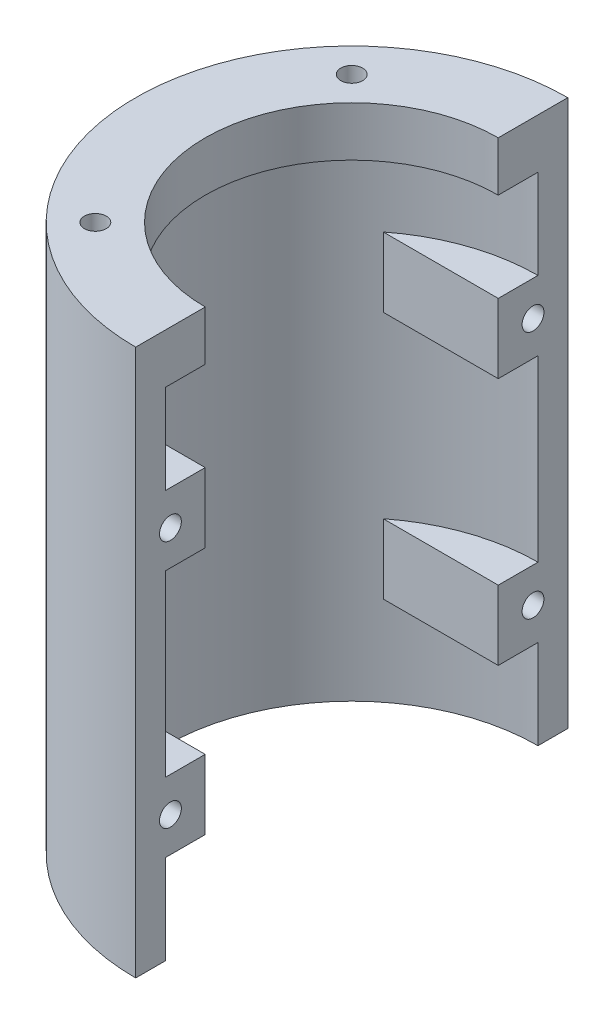
from build123d import *

# Parameters (mm, degrees)
EXTRUDE_1_DEPTH     = 55
CUT_EXTRUDE_START   = -5
SKETCH_2_R          = 18.75
SKETCH_2_R_2        = 14.75
CUT_EXTRUDE_1_DEPTH = 59.016862823
EXTRUDE_3_REACH     = 65.017
SKETCH_4_W          = 7
SKETCH_4_H          = 7
SKETCH_3_R          = 1.1
CUT_EXTRUDE_2_DEPTH = 5
SKETCH_5_R          = 1.1
CUT_EXTRUDE_3_DEPTH = 4


with BuildPart() as part:
    # ｽｹｯﾁ1 → ﾎﾞｽ - 押し出し1 (new body)
    with BuildSketch(Plane(origin=(0, 0, 0), x_dir=(1, 0, 0), z_dir=(0, 1, 0))):
        with BuildLine():
            Line((0, -21.75), (0, -14.75))
            ThreePointArc((0, -14.75), (-14.75, 0), (0, 14.75))
            Line((0, 14.75), (0, 21.75))
            ThreePointArc((0, 21.75), (-21.75, 0), (0, -21.75))
        make_face()
    extrude(amount=EXTRUDE_1_DEPTH)

    # ｽｹｯﾁ2 → ｶｯﾄ - 押し出し1 (cut, through all)
    with BuildSketch(Plane(origin=(0, 55, 0), x_dir=(1, 0, 0), z_dir=(0, 1, 0)).offset(CUT_EXTRUDE_START)):
        Circle(SKETCH_2_R)
        Circle(SKETCH_2_R_2, mode=Mode.SUBTRACT)
    extrude(amount=-CUT_EXTRUDE_1_DEPTH, mode=Mode.SUBTRACT)

    # ｽｹｯﾁ4 → ﾎﾞｽ - 押し出し3 (add, up to next)
    with BuildSketch(Plane(origin=(0, 0, 0), x_dir=(0, 0, -1), z_dir=(1, 0, 0)), mode=Mode.PRIVATE) as extrude_3_sk1:
        with Locations((-18.25, 37.5)):
            Rectangle(SKETCH_4_W, SKETCH_4_H)
    extrude_3_tool1 = extrude(extrude_3_sk1.sketch, amount=-EXTRUDE_3_REACH, mode=Mode.PRIVATE) - part.part
    # ｽｹｯﾁ4 → ﾎﾞｽ - 押し出し3 (add, up to next)
    with BuildSketch(Plane(origin=(0, 0, 0), x_dir=(0, 0, -1), z_dir=(1, 0, 0)), mode=Mode.PRIVATE) as extrude_3_sk2:
        with Locations((-18.25, 12.5)):
            Rectangle(SKETCH_4_W, SKETCH_4_H)
    extrude_3_tool2 = extrude(extrude_3_sk2.sketch, amount=-EXTRUDE_3_REACH, mode=Mode.PRIVATE) - part.part
    # ｽｹｯﾁ4 → ﾎﾞｽ - 押し出し3 (add, up to next)
    with BuildSketch(Plane(origin=(0, 0, 0), x_dir=(0, 0, -1), z_dir=(1, 0, 0)), mode=Mode.PRIVATE) as extrude_3_sk3:
        with Locations((18.25, 12.5)):
            Rectangle(SKETCH_4_W, SKETCH_4_H)
    extrude_3_tool3 = extrude(extrude_3_sk3.sketch, amount=-EXTRUDE_3_REACH, mode=Mode.PRIVATE) - part.part
    # ｽｹｯﾁ4 → ﾎﾞｽ - 押し出し3 (add, up to next)
    with BuildSketch(Plane(origin=(0, 0, 0), x_dir=(0, 0, -1), z_dir=(1, 0, 0)), mode=Mode.PRIVATE) as extrude_3_sk4:
        with Locations((18.25, 37.5)):
            Rectangle(SKETCH_4_W, SKETCH_4_H)
    extrude_3_tool4 = extrude(extrude_3_sk4.sketch, amount=-EXTRUDE_3_REACH, mode=Mode.PRIVATE) - part.part
    add(extrude_3_tool1.solids().sort_by_distance((0, 37.5, 18.25))[0])
    add(extrude_3_tool2.solids().sort_by_distance((0, 12.5, 18.25))[0])
    add(extrude_3_tool3.solids().sort_by_distance((0, 12.5, -18.25))[0])
    add(extrude_3_tool4.solids().sort_by_distance((0, 37.5, -18.25))[0])

    # ｽｹｯﾁ3 → ｶｯﾄ - 押し出し2 (cut)
    with BuildSketch(Plane(origin=(0, 0, 0), x_dir=(0, 0, -1), z_dir=(1, 0, 0))):
        with Locations((-18.25, 37.5)):
            Circle(SKETCH_3_R)
        with Locations((18.25, 37.5)):
            Circle(SKETCH_3_R)
        with Locations((18.25, 12.5)):
            Circle(SKETCH_3_R)
        with Locations((-18.25, 12.5)):
            Circle(SKETCH_3_R)
    extrude(amount=-CUT_EXTRUDE_2_DEPTH, mode=Mode.SUBTRACT)

    # ｽｹｯﾁ5 → ｶｯﾄ - 押し出し3 (cut)
    with BuildSketch(Plane(origin=(0, 55, 0), x_dir=(1, 0, 0), z_dir=(0, 1, 0))):
        with Locations((-12.904698757, -12.904698757)):
            Circle(SKETCH_5_R)
        with Locations((-12.904698757, 12.904698757)):
            Circle(SKETCH_5_R)
    extrude(amount=-CUT_EXTRUDE_3_DEPTH, mode=Mode.SUBTRACT)


solid = part.part
